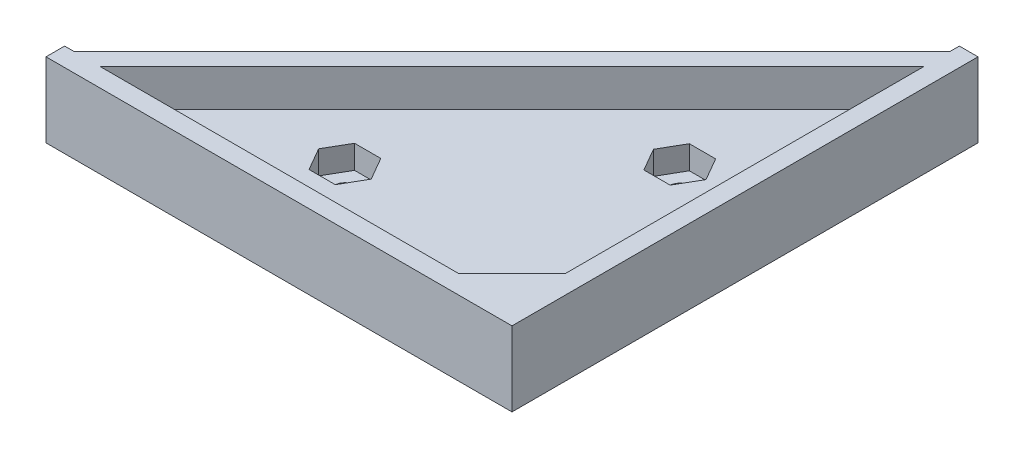
from build123d import *

# Parameters (mm, degrees)
BOSS_EXTRUDE1_DEPTH = 12.7
CUT_EXTRUDE1_DEPTH  = 6.35
CHAMFER1_SIZE       = 6.35
SKETCH3_R           = 1.75
CUT_EXTRUDE2_DEPTH  = 6.35
SKETCH4_R           = 1.75
CUT_EXTRUDE3_DEPTH  = 4


with BuildPart() as part:
    # Sketch1 → Boss-Extrude1 (new body)
    with BuildSketch(Plane(origin=(0, 0, 0), x_dir=(1, 0, 0), z_dir=(0, 1, 0))):
        Polygon((-79.375, 0), (0, 0), (0, 79.375), (-3.175, 79.375), (-3.175, 77.7875), (-77.7875, 3.175), (-79.375, 3.175), align=None)
    extrude(amount=BOSS_EXTRUDE1_DEPTH)

    # Sketch2 → Cut-Extrude1 (cut)
    with BuildSketch(Plane(origin=(0, 12.7, 0), x_dir=(1, 0, 0), z_dir=(0, 1, 0))):
        Polygon((-73.297371939, 3.175), (-12.241098836, 3.175), (-3.175, 12.241098836), (-3.175, 73.297371939), align=None)
    extrude(amount=-CUT_EXTRUDE1_DEPTH, mode=Mode.SUBTRACT)

    # Chamfer1
    chamfer1_edges = [part.edges().sort_by_distance(p)[0] for p in [
        (-7.708049418, 6.35, -7.708049418),
    ]]
    chamfer(chamfer1_edges, length=CHAMFER1_SIZE - 0.0001)  # a hair under: the kernel refuses the full size

    # Sketch3 → Cut-Extrude2 (cut)
    with BuildSketch(Plane(origin=(0, 6.35, 0), x_dir=(1, 0, 0), z_dir=(0, 1, 0))):
        with Locations(Location((-44.460787159, 16.002, 0), (0, 0, 270))):
            Circle(SKETCH3_R)
        with Locations(Location((-15.875, 44.45, 0), (0, 0, 270))):
            Circle(SKETCH3_R)
    extrude(amount=-CUT_EXTRUDE2_DEPTH, mode=Mode.SUBTRACT)

    # Sketch4 → Cut-Extrude3 (cut)
    # profile 1 of 2: a face of its own
    with BuildSketch(Plane(origin=(0, 6.35, 0), x_dir=(1, 0, 0), z_dir=(0, 1, 0))):
        Polygon((-13.637767707, 40.575), (-11.400535414, 44.45), (-13.637767707, 48.325), (-18.112232293, 48.325), (-20.349464586, 44.45), (-18.112232293, 40.575), align=None)
        with Locations(Location((-15.875, 44.45, 0), (0, 0, 270))):
            Circle(SKETCH4_R, mode=Mode.SUBTRACT)
    # profile 2 of 2: a face of its own
    with BuildSketch(Plane(origin=(0, 6.35, 0), x_dir=(1, 0, 0), z_dir=(0, 1, 0))):
        Polygon((-39.986322573, 16.002), (-42.223554866, 19.877), (-46.698019452, 19.877), (-48.935251745, 16.002), (-46.698019452, 12.127), (-42.223554866, 12.127), align=None)
        with Locations(Location((-44.460787159, 16.002, 0), (0, 0, 270))):
            Circle(SKETCH4_R, mode=Mode.SUBTRACT)
    extrude(amount=-CUT_EXTRUDE3_DEPTH, mode=Mode.SUBTRACT)


solid = part.part
